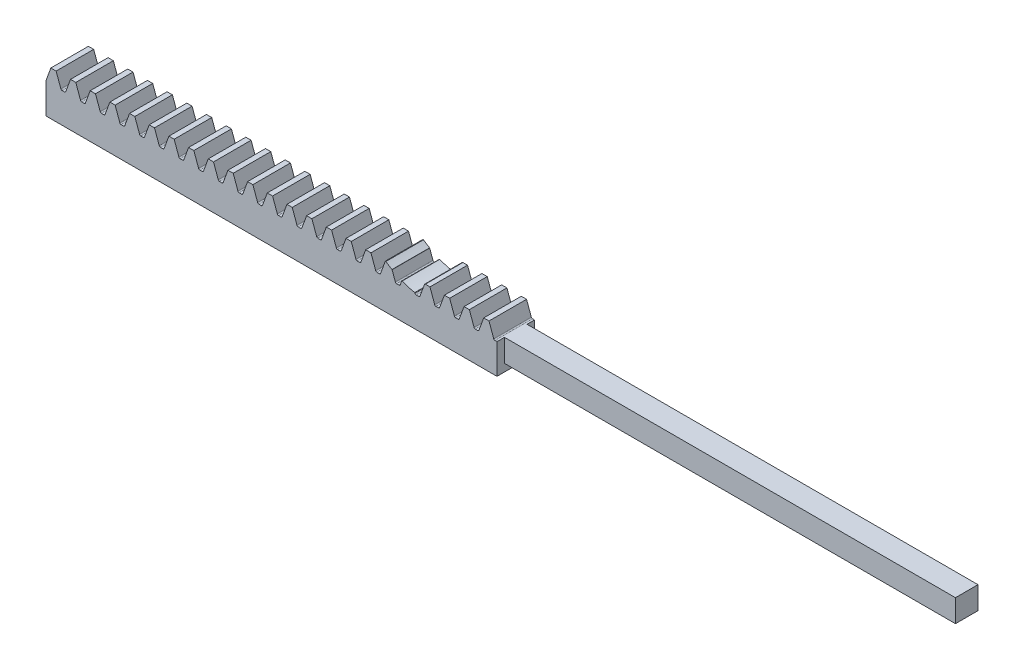
from build123d import *

# Parameters (mm, degrees)
SKETCH1_W                       = 609.6
SKETCH1_H                       = 25.4
BOSS_EXTRUDE1_DEPTH             = 12.7
CUT_EXTRUDE1_DEPTH              = 25.4
FILLET3_R                       = 0.43167355
LPATTERN4_START                 = -12.7
LPATTERN4_DEPTH                 = 25.4
SKETCH5_W                       = 609.6
SKETCH5_H                       = 25.4
CUT_EXTRUDE2_DEPTH              = 10.532533418
SKETCH6_W                       = 609.6
SKETCH6_H                       = 15.910853878
CUT_EXTRUDE3_DEPTH              = 12.7
SKETCH7_W                       = 12.7
SKETCH7_H                       = 14.867466582
CUT_EXTRUDE4_DEPTH              = 457.2
F_1_4_0_25_DIAMETER_HOLE1_D     = 6.35
F_1_4_0_25_DIAMETER_HOLE1_DEPTH = 12.7
F_1_4_0_25_DIAMETER_HOLE1_TIP   = 1.907732465
SKETCH20_W                      = 7.62
SKETCH20_H                      = 7.62
BOSS_EXTRUDE2_DEPTH             = 152.4
CUT_EXTRUDE6_DEPTH              = 12.7
CHAMFER1_SIZE                   = 0.127
CHAMFER1_SIZE2                  = 0.212490963
FILLET4_R                       = 0.127


with BuildPart() as part:
    # Sketch1 → Boss-Extrude1 (new, symmetric)
    with BuildSketch(Plane.XY):
        Rectangle(SKETCH1_W, SKETCH1_H)
    extrude(amount=BOSS_EXTRUDE1_DEPTH, both=True)

    # Sketch2 → Cut-Extrude1 (cut)
    with BuildSketch(Plane.XY.offset(12.7)):
        Polygon((-303.015947325, 12.7), (-301.30256958, 7.992533333), (-299.863657745, 7.992533333), (-298.15028, 12.7), align=None)
    extrude(amount=-CUT_EXTRUDE1_DEPTH, mode=Mode.SUBTRACT)

    # Fillet3
    fillet3_edges = [part.edges().sort_by_distance(p)[0] for p in [
        (-299.863657745, 7.992533333, 0),
        (-301.30256958, 7.992533333, 0),
    ]]
    fillet(fillet3_edges, radius=FILLET3_R)

    # LPattern4: read off the stored shape, not the designer's step
    # LPattern4 outline → LPattern4 (cut)
    with BuildSketch(Plane.XY.offset(LPATTERN4_START)):
        with BuildLine():
            ThreePointArc((-294.756228955, 8.276565834), (-294.598186282, 8.070600612), (-294.350588506, 7.992533333))
            Line((-294.350588506, 7.992533333), (-293.516198819, 7.992533333))
            ThreePointArc((-293.516198819, 7.992533333), (-293.268601043, 8.070600612), (-293.11055837, 8.276565834))
            Line((-293.11055837, 8.276565834), (-291.50056, 12.7))
            Line((-291.50056, 12.7), (-296.366227325, 12.7))
            Line((-296.366227325, 12.7), (-294.756228955, 8.276565834))
        make_face()
        with BuildLine():
            Line((304.8, 12.7), (302.108572675, 12.7))
            Line((302.108572675, 12.7), (303.718571045, 8.276565834))
            ThreePointArc((303.718571045, 8.276565834), (303.876613718, 8.070600612), (304.124211494, 7.992533333))
            Line((304.124211494, 7.992533333), (304.8, 7.992533333))
            Line((304.8, 7.992533333), (304.8, 12.7))
        make_face()
        with BuildLine():
            Line((300.32452, 12.7), (295.458852675, 12.7))
            Line((295.458852675, 12.7), (297.068851045, 8.276565834))
            ThreePointArc((297.068851045, 8.276565834), (297.226893718, 8.070600612), (297.474491494, 7.992533333))
            Line((297.474491494, 7.992533333), (298.308881181, 7.992533333))
            ThreePointArc((298.308881181, 7.992533333), (298.556478957, 8.070600612), (298.71452163, 8.276565834))
            Line((298.71452163, 8.276565834), (300.32452, 12.7))
        make_face()
        with BuildLine():
            Line((293.6748, 12.7), (288.809132675, 12.7))
            Line((288.809132675, 12.7), (290.419131045, 8.276565834))
            ThreePointArc((290.419131045, 8.276565834), (290.577173718, 8.070600612), (290.824771494, 7.992533333))
            Line((290.824771494, 7.992533333), (291.659161181, 7.992533333))
            ThreePointArc((291.659161181, 7.992533333), (291.906758957, 8.070600612), (292.06480163, 8.276565834))
            Line((292.06480163, 8.276565834), (293.6748, 12.7))
        make_face()
        with BuildLine():
            Line((287.02508, 12.7), (282.159412675, 12.7))
            Line((282.159412675, 12.7), (283.769411045, 8.276565834))
            ThreePointArc((283.769411045, 8.276565834), (283.927453718, 8.070600612), (284.175051494, 7.992533333))
            Line((284.175051494, 7.992533333), (285.009441181, 7.992533333))
            ThreePointArc((285.009441181, 7.992533333), (285.257038957, 8.070600612), (285.41508163, 8.276565834))
            Line((285.41508163, 8.276565834), (287.02508, 12.7))
        make_face()
        with BuildLine():
            Line((280.37536, 12.7), (275.509692675, 12.7))
            Line((275.509692675, 12.7), (277.119691045, 8.276565834))
            ThreePointArc((277.119691045, 8.276565834), (277.277733718, 8.070600612), (277.525331494, 7.992533333))
            Line((277.525331494, 7.992533333), (278.359721181, 7.992533333))
            ThreePointArc((278.359721181, 7.992533333), (278.607318957, 8.070600612), (278.76536163, 8.276565834))
            Line((278.76536163, 8.276565834), (280.37536, 12.7))
        make_face()
        with BuildLine():
            Line((273.72564, 12.7), (268.859972675, 12.7))
            Line((268.859972675, 12.7), (270.469971045, 8.276565834))
            ThreePointArc((270.469971045, 8.276565834), (270.628013718, 8.070600612), (270.875611494, 7.992533333))
            Line((270.875611494, 7.992533333), (271.710001181, 7.992533333))
            ThreePointArc((271.710001181, 7.992533333), (271.957598957, 8.070600612), (272.11564163, 8.276565834))
            Line((272.11564163, 8.276565834), (273.72564, 12.7))
        make_face()
        with BuildLine():
            Line((267.07592, 12.7), (262.210252675, 12.7))
            Line((262.210252675, 12.7), (263.820251045, 8.276565834))
            ThreePointArc((263.820251045, 8.276565834), (263.978293718, 8.070600612), (264.225891494, 7.992533333))
            Line((264.225891494, 7.992533333), (265.060281181, 7.992533333))
            ThreePointArc((265.060281181, 7.992533333), (265.307878957, 8.070600612), (265.46592163, 8.276565834))
            Line((265.46592163, 8.276565834), (267.07592, 12.7))
        make_face()
        with BuildLine():
            Line((260.4262, 12.7), (255.560532675, 12.7))
            Line((255.560532675, 12.7), (257.170531045, 8.276565834))
            ThreePointArc((257.170531045, 8.276565834), (257.328573718, 8.070600612), (257.576171494, 7.992533333))
            Line((257.576171494, 7.992533333), (258.410561181, 7.992533333))
            ThreePointArc((258.410561181, 7.992533333), (258.658158957, 8.070600612), (258.81620163, 8.276565834))
            Line((258.81620163, 8.276565834), (260.4262, 12.7))
        make_face()
        with BuildLine():
            Line((253.77648, 12.7), (248.910812675, 12.7))
            Line((248.910812675, 12.7), (250.520811045, 8.276565834))
            ThreePointArc((250.520811045, 8.276565834), (250.678853718, 8.070600612), (250.926451494, 7.992533333))
            Line((250.926451494, 7.992533333), (251.760841181, 7.992533333))
            ThreePointArc((251.760841181, 7.992533333), (252.008438957, 8.070600612), (252.16648163, 8.276565834))
            Line((252.16648163, 8.276565834), (253.77648, 12.7))
        make_face()
        with BuildLine():
            Line((247.12676, 12.7), (242.261092675, 12.7))
            Line((242.261092675, 12.7), (243.871091045, 8.276565834))
            ThreePointArc((243.871091045, 8.276565834), (244.029133718, 8.070600612), (244.276731494, 7.992533333))
            Line((244.276731494, 7.992533333), (245.111121181, 7.992533333))
            ThreePointArc((245.111121181, 7.992533333), (245.358718957, 8.070600612), (245.51676163, 8.276565834))
            Line((245.51676163, 8.276565834), (247.12676, 12.7))
        make_face()
        with BuildLine():
            Line((240.47704, 12.7), (235.611372675, 12.7))
            Line((235.611372675, 12.7), (237.221371045, 8.276565834))
            ThreePointArc((237.221371045, 8.276565834), (237.379413718, 8.070600612), (237.627011494, 7.992533333))
            Line((237.627011494, 7.992533333), (238.461401181, 7.992533333))
            ThreePointArc((238.461401181, 7.992533333), (238.708998957, 8.070600612), (238.86704163, 8.276565834))
            Line((238.86704163, 8.276565834), (240.47704, 12.7))
        make_face()
        with BuildLine():
            Line((233.82732, 12.7), (228.961652675, 12.7))
            Line((228.961652675, 12.7), (230.571651045, 8.276565834))
            ThreePointArc((230.571651045, 8.276565834), (230.729693718, 8.070600612), (230.977291494, 7.992533333))
            Line((230.977291494, 7.992533333), (231.811681181, 7.992533333))
            ThreePointArc((231.811681181, 7.992533333), (232.059278957, 8.070600612), (232.21732163, 8.276565834))
            Line((232.21732163, 8.276565834), (233.82732, 12.7))
        make_face()
        with BuildLine():
            Line((227.1776, 12.7), (222.311932675, 12.7))
            Line((222.311932675, 12.7), (223.921931045, 8.276565834))
            ThreePointArc((223.921931045, 8.276565834), (224.079973718, 8.070600612), (224.327571494, 7.992533333))
            Line((224.327571494, 7.992533333), (225.161961181, 7.992533333))
            ThreePointArc((225.161961181, 7.992533333), (225.409558957, 8.070600612), (225.56760163, 8.276565834))
            Line((225.56760163, 8.276565834), (227.1776, 12.7))
        make_face()
        with BuildLine():
            Line((220.52788, 12.7), (215.662212675, 12.7))
            Line((215.662212675, 12.7), (217.272211045, 8.276565834))
            ThreePointArc((217.272211045, 8.276565834), (217.430253718, 8.070600612), (217.677851494, 7.992533333))
            Line((217.677851494, 7.992533333), (218.512241181, 7.992533333))
            ThreePointArc((218.512241181, 7.992533333), (218.759838957, 8.070600612), (218.91788163, 8.276565834))
            Line((218.91788163, 8.276565834), (220.52788, 12.7))
        make_face()
        with BuildLine():
            Line((213.87816, 12.7), (209.012492675, 12.7))
            Line((209.012492675, 12.7), (210.622491045, 8.276565834))
            ThreePointArc((210.622491045, 8.276565834), (210.780533718, 8.070600612), (211.028131494, 7.992533333))
            Line((211.028131494, 7.992533333), (211.862521181, 7.992533333))
            ThreePointArc((211.862521181, 7.992533333), (212.110118957, 8.070600612), (212.26816163, 8.276565834))
            Line((212.26816163, 8.276565834), (213.87816, 12.7))
        make_face()
        with BuildLine():
            Line((207.22844, 12.7), (202.362772675, 12.7))
            Line((202.362772675, 12.7), (203.972771045, 8.276565834))
            ThreePointArc((203.972771045, 8.276565834), (204.130813718, 8.070600612), (204.378411494, 7.992533333))
            Line((204.378411494, 7.992533333), (205.212801181, 7.992533333))
            ThreePointArc((205.212801181, 7.992533333), (205.460398957, 8.070600612), (205.61844163, 8.276565834))
            Line((205.61844163, 8.276565834), (207.22844, 12.7))
        make_face()
        with BuildLine():
            Line((200.57872, 12.7), (195.713052675, 12.7))
            Line((195.713052675, 12.7), (197.323051045, 8.276565834))
            ThreePointArc((197.323051045, 8.276565834), (197.481093718, 8.070600612), (197.728691494, 7.992533333))
            Line((197.728691494, 7.992533333), (198.563081181, 7.992533333))
            ThreePointArc((198.563081181, 7.992533333), (198.810678957, 8.070600612), (198.96872163, 8.276565834))
            Line((198.96872163, 8.276565834), (200.57872, 12.7))
        make_face()
        with BuildLine():
            Line((193.929, 12.7), (189.063332675, 12.7))
            Line((189.063332675, 12.7), (190.673331045, 8.276565834))
            ThreePointArc((190.673331045, 8.276565834), (190.831373718, 8.070600612), (191.078971494, 7.992533333))
            Line((191.078971494, 7.992533333), (191.913361181, 7.992533333))
            ThreePointArc((191.913361181, 7.992533333), (192.160958957, 8.070600612), (192.31900163, 8.276565834))
            Line((192.31900163, 8.276565834), (193.929, 12.7))
        make_face()
        with BuildLine():
            Line((187.27928, 12.7), (182.413612675, 12.7))
            Line((182.413612675, 12.7), (184.023611045, 8.276565834))
            ThreePointArc((184.023611045, 8.276565834), (184.181653718, 8.070600612), (184.429251494, 7.992533333))
            Line((184.429251494, 7.992533333), (185.263641181, 7.992533333))
            ThreePointArc((185.263641181, 7.992533333), (185.511238957, 8.070600612), (185.66928163, 8.276565834))
            Line((185.66928163, 8.276565834), (187.27928, 12.7))
        make_face()
        with BuildLine():
            Line((180.62956, 12.7), (175.763892675, 12.7))
            Line((175.763892675, 12.7), (177.373891045, 8.276565834))
            ThreePointArc((177.373891045, 8.276565834), (177.531933718, 8.070600612), (177.779531494, 7.992533333))
            Line((177.779531494, 7.992533333), (178.613921181, 7.992533333))
            ThreePointArc((178.613921181, 7.992533333), (178.861518957, 8.070600612), (179.01956163, 8.276565834))
            Line((179.01956163, 8.276565834), (180.62956, 12.7))
        make_face()
        with BuildLine():
            Line((173.97984, 12.7), (169.114172675, 12.7))
            Line((169.114172675, 12.7), (170.724171045, 8.276565834))
            ThreePointArc((170.724171045, 8.276565834), (170.882213718, 8.070600612), (171.129811494, 7.992533333))
            Line((171.129811494, 7.992533333), (171.964201181, 7.992533333))
            ThreePointArc((171.964201181, 7.992533333), (172.211798957, 8.070600612), (172.36984163, 8.276565834))
            Line((172.36984163, 8.276565834), (173.97984, 12.7))
        make_face()
        with BuildLine():
            Line((167.33012, 12.7), (162.464452675, 12.7))
            Line((162.464452675, 12.7), (164.074451045, 8.276565834))
            ThreePointArc((164.074451045, 8.276565834), (164.232493718, 8.070600612), (164.480091494, 7.992533333))
            Line((164.480091494, 7.992533333), (165.314481181, 7.992533333))
            ThreePointArc((165.314481181, 7.992533333), (165.562078957, 8.070600612), (165.72012163, 8.276565834))
            Line((165.72012163, 8.276565834), (167.33012, 12.7))
        make_face()
        with BuildLine():
            Line((160.6804, 12.7), (155.814732675, 12.7))
            Line((155.814732675, 12.7), (157.424731045, 8.276565834))
            ThreePointArc((157.424731045, 8.276565834), (157.582773718, 8.070600612), (157.830371494, 7.992533333))
            Line((157.830371494, 7.992533333), (158.664761181, 7.992533333))
            ThreePointArc((158.664761181, 7.992533333), (158.912358957, 8.070600612), (159.07040163, 8.276565834))
            Line((159.07040163, 8.276565834), (160.6804, 12.7))
        make_face()
        with BuildLine():
            Line((154.03068, 12.7), (149.165012675, 12.7))
            Line((149.165012675, 12.7), (150.775011045, 8.276565834))
            ThreePointArc((150.775011045, 8.276565834), (150.933053718, 8.070600612), (151.180651494, 7.992533333))
            Line((151.180651494, 7.992533333), (152.015041181, 7.992533333))
            ThreePointArc((152.015041181, 7.992533333), (152.262638957, 8.070600612), (152.42068163, 8.276565834))
            Line((152.42068163, 8.276565834), (154.03068, 12.7))
        make_face()
        with BuildLine():
            Line((147.38096, 12.7), (142.515292675, 12.7))
            Line((142.515292675, 12.7), (144.125291045, 8.276565834))
            ThreePointArc((144.125291045, 8.276565834), (144.283333718, 8.070600612), (144.530931494, 7.992533333))
            Line((144.530931494, 7.992533333), (145.365321181, 7.992533333))
            ThreePointArc((145.365321181, 7.992533333), (145.612918957, 8.070600612), (145.77096163, 8.276565834))
            Line((145.77096163, 8.276565834), (147.38096, 12.7))
        make_face()
        with BuildLine():
            Line((140.73124, 12.7), (135.865572675, 12.7))
            Line((135.865572675, 12.7), (137.475571045, 8.276565834))
            ThreePointArc((137.475571045, 8.276565834), (137.633613718, 8.070600612), (137.881211494, 7.992533333))
            Line((137.881211494, 7.992533333), (138.715601181, 7.992533333))
            ThreePointArc((138.715601181, 7.992533333), (138.963198957, 8.070600612), (139.12124163, 8.276565834))
            Line((139.12124163, 8.276565834), (140.73124, 12.7))
        make_face()
        with BuildLine():
            Line((134.08152, 12.7), (129.215852675, 12.7))
            Line((129.215852675, 12.7), (130.825851045, 8.276565834))
            ThreePointArc((130.825851045, 8.276565834), (130.983893718, 8.070600612), (131.231491494, 7.992533333))
            Line((131.231491494, 7.992533333), (132.065881181, 7.992533333))
            ThreePointArc((132.065881181, 7.992533333), (132.313478957, 8.070600612), (132.47152163, 8.276565834))
            Line((132.47152163, 8.276565834), (134.08152, 12.7))
        make_face()
        with BuildLine():
            Line((127.4318, 12.7), (122.566132675, 12.7))
            Line((122.566132675, 12.7), (124.176131045, 8.276565834))
            ThreePointArc((124.176131045, 8.276565834), (124.334173718, 8.070600612), (124.581771494, 7.992533333))
            Line((124.581771494, 7.992533333), (125.416161181, 7.992533333))
            ThreePointArc((125.416161181, 7.992533333), (125.663758957, 8.070600612), (125.82180163, 8.276565834))
            Line((125.82180163, 8.276565834), (127.4318, 12.7))
        make_face()
        with BuildLine():
            Line((120.78208, 12.7), (115.916412675, 12.7))
            Line((115.916412675, 12.7), (117.526411045, 8.276565834))
            ThreePointArc((117.526411045, 8.276565834), (117.684453718, 8.070600612), (117.932051494, 7.992533333))
            Line((117.932051494, 7.992533333), (118.766441181, 7.992533333))
            ThreePointArc((118.766441181, 7.992533333), (119.014038957, 8.070600612), (119.17208163, 8.276565834))
            Line((119.17208163, 8.276565834), (120.78208, 12.7))
        make_face()
        with BuildLine():
            Line((114.13236, 12.7), (109.266692675, 12.7))
            Line((109.266692675, 12.7), (110.876691045, 8.276565834))
            ThreePointArc((110.876691045, 8.276565834), (111.034733718, 8.070600612), (111.282331494, 7.992533333))
            Line((111.282331494, 7.992533333), (112.116721181, 7.992533333))
            ThreePointArc((112.116721181, 7.992533333), (112.364318957, 8.070600612), (112.52236163, 8.276565834))
            Line((112.52236163, 8.276565834), (114.13236, 12.7))
        make_face()
        with BuildLine():
            Line((107.48264, 12.7), (102.616972675, 12.7))
            Line((102.616972675, 12.7), (104.226971045, 8.276565834))
            ThreePointArc((104.226971045, 8.276565834), (104.385013718, 8.070600612), (104.632611494, 7.992533333))
            Line((104.632611494, 7.992533333), (105.467001181, 7.992533333))
            ThreePointArc((105.467001181, 7.992533333), (105.714598957, 8.070600612), (105.87264163, 8.276565834))
            Line((105.87264163, 8.276565834), (107.48264, 12.7))
        make_face()
        with BuildLine():
            Line((100.83292, 12.7), (95.967252675, 12.7))
            Line((95.967252675, 12.7), (97.577251045, 8.276565834))
            ThreePointArc((97.577251045, 8.276565834), (97.735293718, 8.070600612), (97.982891494, 7.992533333))
            Line((97.982891494, 7.992533333), (98.817281181, 7.992533333))
            ThreePointArc((98.817281181, 7.992533333), (99.064878957, 8.070600612), (99.22292163, 8.276565834))
            Line((99.22292163, 8.276565834), (100.83292, 12.7))
        make_face()
        with BuildLine():
            Line((94.1832, 12.7), (89.317532675, 12.7))
            Line((89.317532675, 12.7), (90.927531045, 8.276565834))
            ThreePointArc((90.927531045, 8.276565834), (91.085573718, 8.070600612), (91.333171494, 7.992533333))
            Line((91.333171494, 7.992533333), (92.167561181, 7.992533333))
            ThreePointArc((92.167561181, 7.992533333), (92.415158957, 8.070600612), (92.57320163, 8.276565834))
            Line((92.57320163, 8.276565834), (94.1832, 12.7))
        make_face()
        with BuildLine():
            Line((87.53348, 12.7), (82.667812675, 12.7))
            Line((82.667812675, 12.7), (84.277811045, 8.276565834))
            ThreePointArc((84.277811045, 8.276565834), (84.435853718, 8.070600612), (84.683451494, 7.992533333))
            Line((84.683451494, 7.992533333), (85.517841181, 7.992533333))
            ThreePointArc((85.517841181, 7.992533333), (85.765438957, 8.070600612), (85.92348163, 8.276565834))
            Line((85.92348163, 8.276565834), (87.53348, 12.7))
        make_face()
        with BuildLine():
            Line((80.88376, 12.7), (76.018092675, 12.7))
            Line((76.018092675, 12.7), (77.628091045, 8.276565834))
            ThreePointArc((77.628091045, 8.276565834), (77.786133718, 8.070600612), (78.033731494, 7.992533333))
            Line((78.033731494, 7.992533333), (78.868121181, 7.992533333))
            ThreePointArc((78.868121181, 7.992533333), (79.115718957, 8.070600612), (79.27376163, 8.276565834))
            Line((79.27376163, 8.276565834), (80.88376, 12.7))
        make_face()
        with BuildLine():
            Line((74.23404, 12.7), (69.368372675, 12.7))
            Line((69.368372675, 12.7), (70.978371045, 8.276565834))
            ThreePointArc((70.978371045, 8.276565834), (71.136413718, 8.070600612), (71.384011494, 7.992533333))
            Line((71.384011494, 7.992533333), (72.218401181, 7.992533333))
            ThreePointArc((72.218401181, 7.992533333), (72.465998957, 8.070600612), (72.62404163, 8.276565834))
            Line((72.62404163, 8.276565834), (74.23404, 12.7))
        make_face()
        with BuildLine():
            Line((67.58432, 12.7), (62.718652675, 12.7))
            Line((62.718652675, 12.7), (64.328651045, 8.276565834))
            ThreePointArc((64.328651045, 8.276565834), (64.486693718, 8.070600612), (64.734291494, 7.992533333))
            Line((64.734291494, 7.992533333), (65.568681181, 7.992533333))
            ThreePointArc((65.568681181, 7.992533333), (65.816278957, 8.070600612), (65.97432163, 8.276565834))
            Line((65.97432163, 8.276565834), (67.58432, 12.7))
        make_face()
        with BuildLine():
            Line((60.9346, 12.7), (56.068932675, 12.7))
            Line((56.068932675, 12.7), (57.678931045, 8.276565834))
            ThreePointArc((57.678931045, 8.276565834), (57.836973718, 8.070600612), (58.084571494, 7.992533333))
            Line((58.084571494, 7.992533333), (58.918961181, 7.992533333))
            ThreePointArc((58.918961181, 7.992533333), (59.166558957, 8.070600612), (59.32460163, 8.276565834))
            Line((59.32460163, 8.276565834), (60.9346, 12.7))
        make_face()
        with BuildLine():
            Line((54.28488, 12.7), (49.419212675, 12.7))
            Line((49.419212675, 12.7), (51.029211045, 8.276565834))
            ThreePointArc((51.029211045, 8.276565834), (51.187253718, 8.070600612), (51.434851494, 7.992533333))
            Line((51.434851494, 7.992533333), (52.269241181, 7.992533333))
            ThreePointArc((52.269241181, 7.992533333), (52.516838957, 8.070600612), (52.67488163, 8.276565834))
            Line((52.67488163, 8.276565834), (54.28488, 12.7))
        make_face()
        with BuildLine():
            Line((47.63516, 12.7), (42.769492675, 12.7))
            Line((42.769492675, 12.7), (44.379491045, 8.276565834))
            ThreePointArc((44.379491045, 8.276565834), (44.537533718, 8.070600612), (44.785131494, 7.992533333))
            Line((44.785131494, 7.992533333), (45.619521181, 7.992533333))
            ThreePointArc((45.619521181, 7.992533333), (45.867118957, 8.070600612), (46.02516163, 8.276565834))
            Line((46.02516163, 8.276565834), (47.63516, 12.7))
        make_face()
        with BuildLine():
            Line((40.98544, 12.7), (36.119772675, 12.7))
            Line((36.119772675, 12.7), (37.729771045, 8.276565834))
            ThreePointArc((37.729771045, 8.276565834), (37.887813718, 8.070600612), (38.135411494, 7.992533333))
            Line((38.135411494, 7.992533333), (38.969801181, 7.992533333))
            ThreePointArc((38.969801181, 7.992533333), (39.217398957, 8.070600612), (39.37544163, 8.276565834))
            Line((39.37544163, 8.276565834), (40.98544, 12.7))
        make_face()
        with BuildLine():
            Line((34.33572, 12.7), (29.470052675, 12.7))
            Line((29.470052675, 12.7), (31.080051045, 8.276565834))
            ThreePointArc((31.080051045, 8.276565834), (31.238093718, 8.070600612), (31.485691494, 7.992533333))
            Line((31.485691494, 7.992533333), (32.320081181, 7.992533333))
            ThreePointArc((32.320081181, 7.992533333), (32.567678957, 8.070600612), (32.72572163, 8.276565834))
            Line((32.72572163, 8.276565834), (34.33572, 12.7))
        make_face()
        with BuildLine():
            Line((27.686, 12.7), (22.820332675, 12.7))
            Line((22.820332675, 12.7), (24.430331045, 8.276565834))
            ThreePointArc((24.430331045, 8.276565834), (24.588373718, 8.070600612), (24.835971494, 7.992533333))
            Line((24.835971494, 7.992533333), (25.670361181, 7.992533333))
            ThreePointArc((25.670361181, 7.992533333), (25.917958957, 8.070600612), (26.07600163, 8.276565834))
            Line((26.07600163, 8.276565834), (27.686, 12.7))
        make_face()
        with BuildLine():
            Line((21.03628, 12.7), (16.170612675, 12.7))
            Line((16.170612675, 12.7), (17.780611045, 8.276565834))
            ThreePointArc((17.780611045, 8.276565834), (17.938653718, 8.070600612), (18.186251494, 7.992533333))
            Line((18.186251494, 7.992533333), (19.020641181, 7.992533333))
            ThreePointArc((19.020641181, 7.992533333), (19.268238957, 8.070600612), (19.42628163, 8.276565834))
            Line((19.42628163, 8.276565834), (21.03628, 12.7))
        make_face()
        with BuildLine():
            Line((14.38656, 12.7), (9.520892675, 12.7))
            Line((9.520892675, 12.7), (11.130891045, 8.276565834))
            ThreePointArc((11.130891045, 8.276565834), (11.288933718, 8.070600612), (11.536531494, 7.992533333))
            Line((11.536531494, 7.992533333), (12.370921181, 7.992533333))
            ThreePointArc((12.370921181, 7.992533333), (12.618518957, 8.070600612), (12.77656163, 8.276565834))
            Line((12.77656163, 8.276565834), (14.38656, 12.7))
        make_face()
        with BuildLine():
            Line((7.73684, 12.7), (2.871172675, 12.7))
            Line((2.871172675, 12.7), (4.481171045, 8.276565834))
            ThreePointArc((4.481171045, 8.276565834), (4.639213718, 8.070600612), (4.886811494, 7.992533333))
            Line((4.886811494, 7.992533333), (5.721201181, 7.992533333))
            ThreePointArc((5.721201181, 7.992533333), (5.968798957, 8.070600612), (6.12684163, 8.276565834))
            Line((6.12684163, 8.276565834), (7.73684, 12.7))
        make_face()
        with BuildLine():
            Line((1.08712, 12.7), (-3.778547325, 12.7))
            Line((-3.778547325, 12.7), (-2.168548955, 8.276565834))
            ThreePointArc((-2.168548955, 8.276565834), (-2.010506282, 8.070600612), (-1.762908506, 7.992533333))
            Line((-1.762908506, 7.992533333), (-0.928518819, 7.992533333))
            ThreePointArc((-0.928518819, 7.992533333), (-0.680921043, 8.070600612), (-0.52287837, 8.276565834))
            Line((-0.52287837, 8.276565834), (1.08712, 12.7))
        make_face()
        with BuildLine():
            Line((-5.5626, 12.7), (-10.428267325, 12.7))
            Line((-10.428267325, 12.7), (-8.818268955, 8.276565834))
            ThreePointArc((-8.818268955, 8.276565834), (-8.660226282, 8.070600612), (-8.412628506, 7.992533333))
            Line((-8.412628506, 7.992533333), (-7.578238819, 7.992533333))
            ThreePointArc((-7.578238819, 7.992533333), (-7.330641043, 8.070600612), (-7.17259837, 8.276565834))
            Line((-7.17259837, 8.276565834), (-5.5626, 12.7))
        make_face()
        with BuildLine():
            Line((-12.21232, 12.7), (-17.077987325, 12.7))
            Line((-17.077987325, 12.7), (-15.467988955, 8.276565834))
            ThreePointArc((-15.467988955, 8.276565834), (-15.309946282, 8.070600612), (-15.062348506, 7.992533333))
            Line((-15.062348506, 7.992533333), (-14.227958819, 7.992533333))
            ThreePointArc((-14.227958819, 7.992533333), (-13.980361043, 8.070600612), (-13.82231837, 8.276565834))
            Line((-13.82231837, 8.276565834), (-12.21232, 12.7))
        make_face()
        with BuildLine():
            Line((-18.86204, 12.7), (-23.727707325, 12.7))
            Line((-23.727707325, 12.7), (-22.117708955, 8.276565834))
            ThreePointArc((-22.117708955, 8.276565834), (-21.959666282, 8.070600612), (-21.712068506, 7.992533333))
            Line((-21.712068506, 7.992533333), (-20.877678819, 7.992533333))
            ThreePointArc((-20.877678819, 7.992533333), (-20.630081043, 8.070600612), (-20.47203837, 8.276565834))
            Line((-20.47203837, 8.276565834), (-18.86204, 12.7))
        make_face()
        with BuildLine():
            Line((-25.51176, 12.7), (-30.377427325, 12.7))
            Line((-30.377427325, 12.7), (-28.767428955, 8.276565834))
            ThreePointArc((-28.767428955, 8.276565834), (-28.609386282, 8.070600612), (-28.361788506, 7.992533333))
            Line((-28.361788506, 7.992533333), (-27.527398819, 7.992533333))
            ThreePointArc((-27.527398819, 7.992533333), (-27.279801043, 8.070600612), (-27.12175837, 8.276565834))
            Line((-27.12175837, 8.276565834), (-25.51176, 12.7))
        make_face()
        with BuildLine():
            Line((-32.16148, 12.7), (-37.027147325, 12.7))
            Line((-37.027147325, 12.7), (-35.417148955, 8.276565834))
            ThreePointArc((-35.417148955, 8.276565834), (-35.259106282, 8.070600612), (-35.011508506, 7.992533333))
            Line((-35.011508506, 7.992533333), (-34.177118819, 7.992533333))
            ThreePointArc((-34.177118819, 7.992533333), (-33.929521043, 8.070600612), (-33.77147837, 8.276565834))
            Line((-33.77147837, 8.276565834), (-32.16148, 12.7))
        make_face()
        with BuildLine():
            Line((-38.8112, 12.7), (-43.676867325, 12.7))
            Line((-43.676867325, 12.7), (-42.066868955, 8.276565834))
            ThreePointArc((-42.066868955, 8.276565834), (-41.908826282, 8.070600612), (-41.661228506, 7.992533333))
            Line((-41.661228506, 7.992533333), (-40.826838819, 7.992533333))
            ThreePointArc((-40.826838819, 7.992533333), (-40.579241043, 8.070600612), (-40.42119837, 8.276565834))
            Line((-40.42119837, 8.276565834), (-38.8112, 12.7))
        make_face()
        with BuildLine():
            Line((-45.46092, 12.7), (-50.326587325, 12.7))
            Line((-50.326587325, 12.7), (-48.716588955, 8.276565834))
            ThreePointArc((-48.716588955, 8.276565834), (-48.558546282, 8.070600612), (-48.310948506, 7.992533333))
            Line((-48.310948506, 7.992533333), (-47.476558819, 7.992533333))
            ThreePointArc((-47.476558819, 7.992533333), (-47.228961043, 8.070600612), (-47.07091837, 8.276565834))
            Line((-47.07091837, 8.276565834), (-45.46092, 12.7))
        make_face()
        with BuildLine():
            Line((-52.11064, 12.7), (-56.976307325, 12.7))
            Line((-56.976307325, 12.7), (-55.366308955, 8.276565834))
            ThreePointArc((-55.366308955, 8.276565834), (-55.208266282, 8.070600612), (-54.960668506, 7.992533333))
            Line((-54.960668506, 7.992533333), (-54.126278819, 7.992533333))
            ThreePointArc((-54.126278819, 7.992533333), (-53.878681043, 8.070600612), (-53.72063837, 8.276565834))
            Line((-53.72063837, 8.276565834), (-52.11064, 12.7))
        make_face()
        with BuildLine():
            Line((-58.76036, 12.7), (-63.626027325, 12.7))
            Line((-63.626027325, 12.7), (-62.016028955, 8.276565834))
            ThreePointArc((-62.016028955, 8.276565834), (-61.857986282, 8.070600612), (-61.610388506, 7.992533333))
            Line((-61.610388506, 7.992533333), (-60.775998819, 7.992533333))
            ThreePointArc((-60.775998819, 7.992533333), (-60.528401043, 8.070600612), (-60.37035837, 8.276565834))
            Line((-60.37035837, 8.276565834), (-58.76036, 12.7))
        make_face()
        with BuildLine():
            Line((-65.41008, 12.7), (-70.275747325, 12.7))
            Line((-70.275747325, 12.7), (-68.665748955, 8.276565834))
            ThreePointArc((-68.665748955, 8.276565834), (-68.507706282, 8.070600612), (-68.260108506, 7.992533333))
            Line((-68.260108506, 7.992533333), (-67.425718819, 7.992533333))
            ThreePointArc((-67.425718819, 7.992533333), (-67.178121043, 8.070600612), (-67.02007837, 8.276565834))
            Line((-67.02007837, 8.276565834), (-65.41008, 12.7))
        make_face()
        with BuildLine():
            Line((-72.0598, 12.7), (-76.925467325, 12.7))
            Line((-76.925467325, 12.7), (-75.315468955, 8.276565834))
            ThreePointArc((-75.315468955, 8.276565834), (-75.157426282, 8.070600612), (-74.909828506, 7.992533333))
            Line((-74.909828506, 7.992533333), (-74.075438819, 7.992533333))
            ThreePointArc((-74.075438819, 7.992533333), (-73.827841043, 8.070600612), (-73.66979837, 8.276565834))
            Line((-73.66979837, 8.276565834), (-72.0598, 12.7))
        make_face()
        with BuildLine():
            Line((-78.70952, 12.7), (-83.575187325, 12.7))
            Line((-83.575187325, 12.7), (-81.965188955, 8.276565834))
            ThreePointArc((-81.965188955, 8.276565834), (-81.807146282, 8.070600612), (-81.559548506, 7.992533333))
            Line((-81.559548506, 7.992533333), (-80.725158819, 7.992533333))
            ThreePointArc((-80.725158819, 7.992533333), (-80.477561043, 8.070600612), (-80.31951837, 8.276565834))
            Line((-80.31951837, 8.276565834), (-78.70952, 12.7))
        make_face()
        with BuildLine():
            Line((-85.35924, 12.7), (-90.224907325, 12.7))
            Line((-90.224907325, 12.7), (-88.614908955, 8.276565834))
            ThreePointArc((-88.614908955, 8.276565834), (-88.456866282, 8.070600612), (-88.209268506, 7.992533333))
            Line((-88.209268506, 7.992533333), (-87.374878819, 7.992533333))
            ThreePointArc((-87.374878819, 7.992533333), (-87.127281043, 8.070600612), (-86.96923837, 8.276565834))
            Line((-86.96923837, 8.276565834), (-85.35924, 12.7))
        make_face()
        with BuildLine():
            Line((-92.00896, 12.7), (-96.874627325, 12.7))
            Line((-96.874627325, 12.7), (-95.264628955, 8.276565834))
            ThreePointArc((-95.264628955, 8.276565834), (-95.106586282, 8.070600612), (-94.858988506, 7.992533333))
            Line((-94.858988506, 7.992533333), (-94.024598819, 7.992533333))
            ThreePointArc((-94.024598819, 7.992533333), (-93.777001043, 8.070600612), (-93.61895837, 8.276565834))
            Line((-93.61895837, 8.276565834), (-92.00896, 12.7))
        make_face()
        with BuildLine():
            Line((-98.65868, 12.7), (-103.524347325, 12.7))
            Line((-103.524347325, 12.7), (-101.914348955, 8.276565834))
            ThreePointArc((-101.914348955, 8.276565834), (-101.756306282, 8.070600612), (-101.508708506, 7.992533333))
            Line((-101.508708506, 7.992533333), (-100.674318819, 7.992533333))
            ThreePointArc((-100.674318819, 7.992533333), (-100.426721043, 8.070600612), (-100.26867837, 8.276565834))
            Line((-100.26867837, 8.276565834), (-98.65868, 12.7))
        make_face()
        with BuildLine():
            Line((-105.3084, 12.7), (-110.174067325, 12.7))
            Line((-110.174067325, 12.7), (-108.564068955, 8.276565834))
            ThreePointArc((-108.564068955, 8.276565834), (-108.406026282, 8.070600612), (-108.158428506, 7.992533333))
            Line((-108.158428506, 7.992533333), (-107.324038819, 7.992533333))
            ThreePointArc((-107.324038819, 7.992533333), (-107.076441043, 8.070600612), (-106.91839837, 8.276565834))
            Line((-106.91839837, 8.276565834), (-105.3084, 12.7))
        make_face()
        with BuildLine():
            Line((-111.95812, 12.7), (-116.823787325, 12.7))
            Line((-116.823787325, 12.7), (-115.213788955, 8.276565834))
            ThreePointArc((-115.213788955, 8.276565834), (-115.055746282, 8.070600612), (-114.808148506, 7.992533333))
            Line((-114.808148506, 7.992533333), (-113.973758819, 7.992533333))
            ThreePointArc((-113.973758819, 7.992533333), (-113.726161043, 8.070600612), (-113.56811837, 8.276565834))
            Line((-113.56811837, 8.276565834), (-111.95812, 12.7))
        make_face()
        with BuildLine():
            Line((-118.60784, 12.7), (-123.473507325, 12.7))
            Line((-123.473507325, 12.7), (-121.863508955, 8.276565834))
            ThreePointArc((-121.863508955, 8.276565834), (-121.705466282, 8.070600612), (-121.457868506, 7.992533333))
            Line((-121.457868506, 7.992533333), (-120.623478819, 7.992533333))
            ThreePointArc((-120.623478819, 7.992533333), (-120.375881043, 8.070600612), (-120.21783837, 8.276565834))
            Line((-120.21783837, 8.276565834), (-118.60784, 12.7))
        make_face()
        with BuildLine():
            Line((-125.25756, 12.7), (-130.123227325, 12.7))
            Line((-130.123227325, 12.7), (-128.513228955, 8.276565834))
            ThreePointArc((-128.513228955, 8.276565834), (-128.355186282, 8.070600612), (-128.107588506, 7.992533333))
            Line((-128.107588506, 7.992533333), (-127.273198819, 7.992533333))
            ThreePointArc((-127.273198819, 7.992533333), (-127.025601043, 8.070600612), (-126.86755837, 8.276565834))
            Line((-126.86755837, 8.276565834), (-125.25756, 12.7))
        make_face()
        with BuildLine():
            Line((-131.90728, 12.7), (-136.772947325, 12.7))
            Line((-136.772947325, 12.7), (-135.162948955, 8.276565834))
            ThreePointArc((-135.162948955, 8.276565834), (-135.004906282, 8.070600612), (-134.757308506, 7.992533333))
            Line((-134.757308506, 7.992533333), (-133.922918819, 7.992533333))
            ThreePointArc((-133.922918819, 7.992533333), (-133.675321043, 8.070600612), (-133.51727837, 8.276565834))
            Line((-133.51727837, 8.276565834), (-131.90728, 12.7))
        make_face()
        with BuildLine():
            Line((-138.557, 12.7), (-143.422667325, 12.7))
            Line((-143.422667325, 12.7), (-141.812668955, 8.276565834))
            ThreePointArc((-141.812668955, 8.276565834), (-141.654626282, 8.070600612), (-141.407028506, 7.992533333))
            Line((-141.407028506, 7.992533333), (-140.572638819, 7.992533333))
            ThreePointArc((-140.572638819, 7.992533333), (-140.325041043, 8.070600612), (-140.16699837, 8.276565834))
            Line((-140.16699837, 8.276565834), (-138.557, 12.7))
        make_face()
        with BuildLine():
            Line((-145.20672, 12.7), (-150.072387325, 12.7))
            Line((-150.072387325, 12.7), (-148.462388955, 8.276565834))
            ThreePointArc((-148.462388955, 8.276565834), (-148.304346282, 8.070600612), (-148.056748506, 7.992533333))
            Line((-148.056748506, 7.992533333), (-147.222358819, 7.992533333))
            ThreePointArc((-147.222358819, 7.992533333), (-146.974761043, 8.070600612), (-146.81671837, 8.276565834))
            Line((-146.81671837, 8.276565834), (-145.20672, 12.7))
        make_face()
        with BuildLine():
            Line((-151.85644, 12.7), (-156.722107325, 12.7))
            Line((-156.722107325, 12.7), (-155.112108955, 8.276565834))
            ThreePointArc((-155.112108955, 8.276565834), (-154.954066282, 8.070600612), (-154.706468506, 7.992533333))
            Line((-154.706468506, 7.992533333), (-153.872078819, 7.992533333))
            ThreePointArc((-153.872078819, 7.992533333), (-153.624481043, 8.070600612), (-153.46643837, 8.276565834))
            Line((-153.46643837, 8.276565834), (-151.85644, 12.7))
        make_face()
        with BuildLine():
            Line((-158.50616, 12.7), (-163.371827325, 12.7))
            Line((-163.371827325, 12.7), (-161.761828955, 8.276565834))
            ThreePointArc((-161.761828955, 8.276565834), (-161.603786282, 8.070600612), (-161.356188506, 7.992533333))
            Line((-161.356188506, 7.992533333), (-160.521798819, 7.992533333))
            ThreePointArc((-160.521798819, 7.992533333), (-160.274201043, 8.070600612), (-160.11615837, 8.276565834))
            Line((-160.11615837, 8.276565834), (-158.50616, 12.7))
        make_face()
        with BuildLine():
            Line((-165.15588, 12.7), (-170.021547325, 12.7))
            Line((-170.021547325, 12.7), (-168.411548955, 8.276565834))
            ThreePointArc((-168.411548955, 8.276565834), (-168.253506282, 8.070600612), (-168.005908506, 7.992533333))
            Line((-168.005908506, 7.992533333), (-167.171518819, 7.992533333))
            ThreePointArc((-167.171518819, 7.992533333), (-166.923921043, 8.070600612), (-166.76587837, 8.276565834))
            Line((-166.76587837, 8.276565834), (-165.15588, 12.7))
        make_face()
        with BuildLine():
            Line((-171.8056, 12.7), (-176.671267325, 12.7))
            Line((-176.671267325, 12.7), (-175.061268955, 8.276565834))
            ThreePointArc((-175.061268955, 8.276565834), (-174.903226282, 8.070600612), (-174.655628506, 7.992533333))
            Line((-174.655628506, 7.992533333), (-173.821238819, 7.992533333))
            ThreePointArc((-173.821238819, 7.992533333), (-173.573641043, 8.070600612), (-173.41559837, 8.276565834))
            Line((-173.41559837, 8.276565834), (-171.8056, 12.7))
        make_face()
        with BuildLine():
            Line((-178.45532, 12.7), (-183.320987325, 12.7))
            Line((-183.320987325, 12.7), (-181.710988955, 8.276565834))
            ThreePointArc((-181.710988955, 8.276565834), (-181.552946282, 8.070600612), (-181.305348506, 7.992533333))
            Line((-181.305348506, 7.992533333), (-180.470958819, 7.992533333))
            ThreePointArc((-180.470958819, 7.992533333), (-180.223361043, 8.070600612), (-180.06531837, 8.276565834))
            Line((-180.06531837, 8.276565834), (-178.45532, 12.7))
        make_face()
        with BuildLine():
            Line((-185.10504, 12.7), (-189.970707325, 12.7))
            Line((-189.970707325, 12.7), (-188.360708955, 8.276565834))
            ThreePointArc((-188.360708955, 8.276565834), (-188.202666282, 8.070600612), (-187.955068506, 7.992533333))
            Line((-187.955068506, 7.992533333), (-187.120678819, 7.992533333))
            ThreePointArc((-187.120678819, 7.992533333), (-186.873081043, 8.070600612), (-186.71503837, 8.276565834))
            Line((-186.71503837, 8.276565834), (-185.10504, 12.7))
        make_face()
        with BuildLine():
            Line((-191.75476, 12.7), (-196.620427325, 12.7))
            Line((-196.620427325, 12.7), (-195.010428955, 8.276565834))
            ThreePointArc((-195.010428955, 8.276565834), (-194.852386282, 8.070600612), (-194.604788506, 7.992533333))
            Line((-194.604788506, 7.992533333), (-193.770398819, 7.992533333))
            ThreePointArc((-193.770398819, 7.992533333), (-193.522801043, 8.070600612), (-193.36475837, 8.276565834))
            Line((-193.36475837, 8.276565834), (-191.75476, 12.7))
        make_face()
        with BuildLine():
            Line((-198.40448, 12.7), (-203.270147325, 12.7))
            Line((-203.270147325, 12.7), (-201.660148955, 8.276565834))
            ThreePointArc((-201.660148955, 8.276565834), (-201.502106282, 8.070600612), (-201.254508506, 7.992533333))
            Line((-201.254508506, 7.992533333), (-200.420118819, 7.992533333))
            ThreePointArc((-200.420118819, 7.992533333), (-200.172521043, 8.070600612), (-200.01447837, 8.276565834))
            Line((-200.01447837, 8.276565834), (-198.40448, 12.7))
        make_face()
        with BuildLine():
            Line((-205.0542, 12.7), (-209.919867325, 12.7))
            Line((-209.919867325, 12.7), (-208.309868955, 8.276565834))
            ThreePointArc((-208.309868955, 8.276565834), (-208.151826282, 8.070600612), (-207.904228506, 7.992533333))
            Line((-207.904228506, 7.992533333), (-207.069838819, 7.992533333))
            ThreePointArc((-207.069838819, 7.992533333), (-206.822241043, 8.070600612), (-206.66419837, 8.276565834))
            Line((-206.66419837, 8.276565834), (-205.0542, 12.7))
        make_face()
        with BuildLine():
            Line((-211.70392, 12.7), (-216.569587325, 12.7))
            Line((-216.569587325, 12.7), (-214.959588955, 8.276565834))
            ThreePointArc((-214.959588955, 8.276565834), (-214.801546282, 8.070600612), (-214.553948506, 7.992533333))
            Line((-214.553948506, 7.992533333), (-213.719558819, 7.992533333))
            ThreePointArc((-213.719558819, 7.992533333), (-213.471961043, 8.070600612), (-213.31391837, 8.276565834))
            Line((-213.31391837, 8.276565834), (-211.70392, 12.7))
        make_face()
        with BuildLine():
            Line((-218.35364, 12.7), (-223.219307325, 12.7))
            Line((-223.219307325, 12.7), (-221.609308955, 8.276565834))
            ThreePointArc((-221.609308955, 8.276565834), (-221.451266282, 8.070600612), (-221.203668506, 7.992533333))
            Line((-221.203668506, 7.992533333), (-220.369278819, 7.992533333))
            ThreePointArc((-220.369278819, 7.992533333), (-220.121681043, 8.070600612), (-219.96363837, 8.276565834))
            Line((-219.96363837, 8.276565834), (-218.35364, 12.7))
        make_face()
        with BuildLine():
            Line((-225.00336, 12.7), (-229.869027325, 12.7))
            Line((-229.869027325, 12.7), (-228.259028955, 8.276565834))
            ThreePointArc((-228.259028955, 8.276565834), (-228.100986282, 8.070600612), (-227.853388506, 7.992533333))
            Line((-227.853388506, 7.992533333), (-227.018998819, 7.992533333))
            ThreePointArc((-227.018998819, 7.992533333), (-226.771401043, 8.070600612), (-226.61335837, 8.276565834))
            Line((-226.61335837, 8.276565834), (-225.00336, 12.7))
        make_face()
        with BuildLine():
            Line((-231.65308, 12.7), (-236.518747325, 12.7))
            Line((-236.518747325, 12.7), (-234.908748955, 8.276565834))
            ThreePointArc((-234.908748955, 8.276565834), (-234.750706282, 8.070600612), (-234.503108506, 7.992533333))
            Line((-234.503108506, 7.992533333), (-233.668718819, 7.992533333))
            ThreePointArc((-233.668718819, 7.992533333), (-233.421121043, 8.070600612), (-233.26307837, 8.276565834))
            Line((-233.26307837, 8.276565834), (-231.65308, 12.7))
        make_face()
        with BuildLine():
            Line((-238.3028, 12.7), (-243.168467325, 12.7))
            Line((-243.168467325, 12.7), (-241.558468955, 8.276565834))
            ThreePointArc((-241.558468955, 8.276565834), (-241.400426282, 8.070600612), (-241.152828506, 7.992533333))
            Line((-241.152828506, 7.992533333), (-240.318438819, 7.992533333))
            ThreePointArc((-240.318438819, 7.992533333), (-240.070841043, 8.070600612), (-239.91279837, 8.276565834))
            Line((-239.91279837, 8.276565834), (-238.3028, 12.7))
        make_face()
        with BuildLine():
            Line((-244.95252, 12.7), (-249.818187325, 12.7))
            Line((-249.818187325, 12.7), (-248.208188955, 8.276565834))
            ThreePointArc((-248.208188955, 8.276565834), (-248.050146282, 8.070600612), (-247.802548506, 7.992533333))
            Line((-247.802548506, 7.992533333), (-246.968158819, 7.992533333))
            ThreePointArc((-246.968158819, 7.992533333), (-246.720561043, 8.070600612), (-246.56251837, 8.276565834))
            Line((-246.56251837, 8.276565834), (-244.95252, 12.7))
        make_face()
        with BuildLine():
            Line((-251.60224, 12.7), (-256.467907325, 12.7))
            Line((-256.467907325, 12.7), (-254.857908955, 8.276565834))
            ThreePointArc((-254.857908955, 8.276565834), (-254.699866282, 8.070600612), (-254.452268506, 7.992533333))
            Line((-254.452268506, 7.992533333), (-253.617878819, 7.992533333))
            ThreePointArc((-253.617878819, 7.992533333), (-253.370281043, 8.070600612), (-253.21223837, 8.276565834))
            Line((-253.21223837, 8.276565834), (-251.60224, 12.7))
        make_face()
        with BuildLine():
            Line((-258.25196, 12.7), (-263.117627325, 12.7))
            Line((-263.117627325, 12.7), (-261.507628955, 8.276565834))
            ThreePointArc((-261.507628955, 8.276565834), (-261.349586282, 8.070600612), (-261.101988506, 7.992533333))
            Line((-261.101988506, 7.992533333), (-260.267598819, 7.992533333))
            ThreePointArc((-260.267598819, 7.992533333), (-260.020001043, 8.070600612), (-259.86195837, 8.276565834))
            Line((-259.86195837, 8.276565834), (-258.25196, 12.7))
        make_face()
        with BuildLine():
            Line((-264.90168, 12.7), (-269.767347325, 12.7))
            Line((-269.767347325, 12.7), (-268.157348955, 8.276565834))
            ThreePointArc((-268.157348955, 8.276565834), (-267.999306282, 8.070600612), (-267.751708506, 7.992533333))
            Line((-267.751708506, 7.992533333), (-266.917318819, 7.992533333))
            ThreePointArc((-266.917318819, 7.992533333), (-266.669721043, 8.070600612), (-266.51167837, 8.276565834))
            Line((-266.51167837, 8.276565834), (-264.90168, 12.7))
        make_face()
        with BuildLine():
            Line((-271.5514, 12.7), (-276.417067325, 12.7))
            Line((-276.417067325, 12.7), (-274.807068955, 8.276565834))
            ThreePointArc((-274.807068955, 8.276565834), (-274.649026282, 8.070600612), (-274.401428506, 7.992533333))
            Line((-274.401428506, 7.992533333), (-273.567038819, 7.992533333))
            ThreePointArc((-273.567038819, 7.992533333), (-273.319441043, 8.070600612), (-273.16139837, 8.276565834))
            Line((-273.16139837, 8.276565834), (-271.5514, 12.7))
        make_face()
        with BuildLine():
            Line((-278.20112, 12.7), (-283.066787325, 12.7))
            Line((-283.066787325, 12.7), (-281.456788955, 8.276565834))
            ThreePointArc((-281.456788955, 8.276565834), (-281.298746282, 8.070600612), (-281.051148506, 7.992533333))
            Line((-281.051148506, 7.992533333), (-280.216758819, 7.992533333))
            ThreePointArc((-280.216758819, 7.992533333), (-279.969161043, 8.070600612), (-279.81111837, 8.276565834))
            Line((-279.81111837, 8.276565834), (-278.20112, 12.7))
        make_face()
        with BuildLine():
            Line((-284.85084, 12.7), (-289.716507325, 12.7))
            Line((-289.716507325, 12.7), (-288.106508955, 8.276565834))
            ThreePointArc((-288.106508955, 8.276565834), (-287.948466282, 8.070600612), (-287.700868506, 7.992533333))
            Line((-287.700868506, 7.992533333), (-286.866478819, 7.992533333))
            ThreePointArc((-286.866478819, 7.992533333), (-286.618881043, 8.070600612), (-286.46083837, 8.276565834))
            Line((-286.46083837, 8.276565834), (-284.85084, 12.7))
        make_face()
    extrude(amount=LPATTERN4_DEPTH, mode=Mode.SUBTRACT)

    # Sketch5 → Cut-Extrude2 (cut)
    with BuildSketch(Plane.XZ.offset(12.7)):
        Rectangle(SKETCH5_W, SKETCH5_H)
    extrude(amount=-CUT_EXTRUDE2_DEPTH, mode=Mode.SUBTRACT)

    # Sketch6 → Cut-Extrude3 (cut)
    with BuildSketch(Plane.XY.offset(12.7)):
        with Locations((0, 5.787960357)):
            Rectangle(SKETCH6_W, SKETCH6_H)
    extrude(amount=-CUT_EXTRUDE3_DEPTH, mode=Mode.SUBTRACT)

    # Sketch7 → Cut-Extrude4 (cut)
    with BuildSketch(Plane.ZY.offset(304.8)):
        with Locations((-6.35, 5.266266709)):
            Rectangle(SKETCH7_W, SKETCH7_H)
    extrude(amount=-CUT_EXTRUDE4_DEPTH, mode=Mode.SUBTRACT)

    # 1/4 (0.25) Diameter Hole1
    with Locations(Plane.ZY.offset(-152.4)):
        with Locations((-6.35, 4.182533418)):
            Hole(F_1_4_0_25_DIAMETER_HOLE1_D / 2, depth=F_1_4_0_25_DIAMETER_HOLE1_DEPTH)
            with Locations((0, 0, -(F_1_4_0_25_DIAMETER_HOLE1_DEPTH + F_1_4_0_25_DIAMETER_HOLE1_TIP / 2))):  # 118° drill point
                Cone(0, F_1_4_0_25_DIAMETER_HOLE1_D / 2, F_1_4_0_25_DIAMETER_HOLE1_TIP, mode=Mode.SUBTRACT)

    # Sketch20 → Boss-Extrude2 (add)
    with BuildSketch(Plane(origin=(304.8, 0, 0), x_dir=(0, 0, -1), z_dir=(1, 0, 0))):
        with Locations((6.35, 4.182533418)):
            Rectangle(SKETCH20_W, SKETCH20_H)
    extrude(amount=BOSS_EXTRUDE2_DEPTH)

    # Sketch24 → Cut-Extrude6 (cut)
    with BuildSketch(Plane.XY):
        with BuildLine():
            ThreePointArc((277.657315225, 57.182376248), (257.033063457, 32.766), (277.657315225, 8.349623752))
            Line((277.657315225, 8.349623752), (277.657315225, 57.182376248))
        make_face()
    extrude(amount=-CUT_EXTRUDE6_DEPTH, mode=Mode.SUBTRACT)

    # Chamfer1
    chamfer1_edges = [part.edges().sort_by_distance(p)[0] for p in [
        (280.37536, 12.7, -6.35),
    ]]
    chamfer1_side = [part.faces().sort_by_distance(p)[0] for p in [
        (279.570360815, 10.488282917, -6.35),
    ]]
    chamfer(chamfer1_edges, length=CHAMFER1_SIZE, length2=CHAMFER1_SIZE2, reference=chamfer1_side[0])

    # Fillet4
    fillet4_edges = [part.edges().sort_by_distance(p)[0] for p in [
        (277.052985016, 8.459839144, -6.35),
        (269.34851947, 11.357728713, -6.35),
        (272.652499988, 9.751572051, -6.35),
    ]]
    fillet(fillet4_edges, radius=FILLET4_R)


solid = part.part
